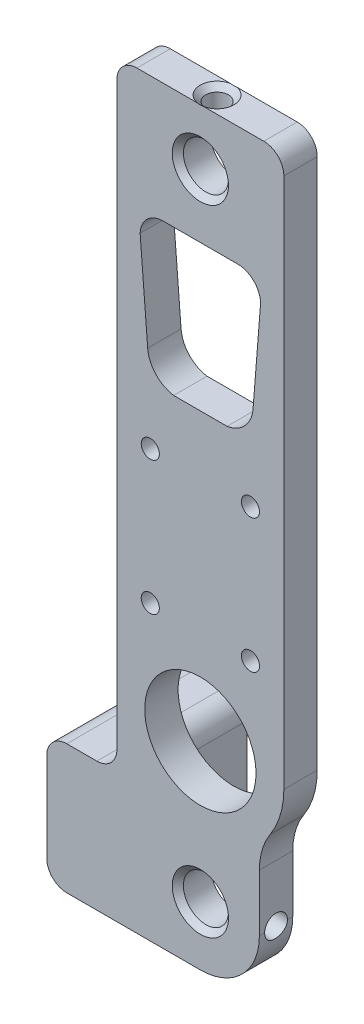
from build123d import *

# Parameters (mm, degrees)
SKETCH1_W           = 30
SKETCH1_H           = 34
SKETCH1_R           = 1.625
BOSS_EXTRUDE1_DEPTH = 6
BOSS_EXTRUDE3_START = -6
SKETCH2_R           = 10
SKETCH2_R_2         = 4.05
BOSS_EXTRUDE3_DEPTH = 6
SKETCH3_R           = 2.1
BOSS_EXTRUDE4_DEPTH = 21.376405408
CUT_EXTRUDE1_START  = -10
CUT_EXTRUDE1_DEPTH  = 10
SKETCH5_W           = 4.7
SKETCH5_H           = 23.2
BOSS_EXTRUDE5_DEPTH = 17.376405408
CUT_EXTRUDE2_DEPTH  = 10
SKETCH8_R           = 2.05
CUT_EXTRUDE3_DEPTH  = 10
SKETCH9_W           = 30
SKETCH9_H           = 53.05
SKETCH9_R           = 4.05
BOSS_EXTRUDE6_DEPTH = 6
SKETCH10_R          = 2.05
CUT_EXTRUDE7_DEPTH  = 10
FILLET2_R           = 3.6
FILLET3_R           = 3.6
CHAMFER1_SIZE       = 1
CHAMFER2_SIZE       = 1


with BuildPart() as part:
    # Sketch1 → Boss-Extrude1 (new body)
    with BuildSketch(Plane.XY):
        Rectangle(SKETCH1_W, SKETCH1_H)
        with Locations((-9, 12)):
            Circle(SKETCH1_R, mode=Mode.SUBTRACT)
        with Locations((9, 12)):
            Circle(SKETCH1_R, mode=Mode.SUBTRACT)
        with Locations((-9, -12)):
            Circle(SKETCH1_R, mode=Mode.SUBTRACT)
        with Locations((9, -12)):
            Circle(SKETCH1_R, mode=Mode.SUBTRACT)
    extrude(amount=-BOSS_EXTRUDE1_DEPTH)

    # Sketch2 → Boss-Extrude3 (add)
    with BuildSketch(Plane.XY.offset(BOSS_EXTRUDE3_START)):
        Polygon((-15, -17), (15, -17), (15, -64.6), (-15, -64.6), (-27.6, -64.6), (-27.6, -41.4), (-15, -41.4), align=None)
        with Locations((0, -29)):
            Circle(SKETCH2_R, mode=Mode.SUBTRACT)
        with Locations((0, -54)):
            Circle(SKETCH2_R_2, mode=Mode.SUBTRACT)
    extrude(amount=BOSS_EXTRUDE3_DEPTH)

    # Sketch3 → Boss-Extrude4 (add)
    with BuildSketch(Plane(origin=(0, 0, -6), x_dir=(-1, 0, 0), z_dir=(0, 0, -1))):
        with BuildLine():
            Line((27.6, -61), (27.6, -45))
            ThreePointArc((27.6, -45), (26.545584412, -42.454415588), (24, -41.4))
            Line((24, -41.4), (19.7, -41.4))
            Line((19.7, -41.4), (19.7, -64.6))
            Line((19.7, -64.6), (24, -64.6))
            ThreePointArc((24, -64.6), (26.545584412, -63.545584412), (27.6, -61))
        make_face()
        with Locations(Location((24, -61, 0), (0, 0, 180))):
            Circle(SKETCH3_R, mode=Mode.SUBTRACT)
        with Locations(Location((24, -45, 0), (0, 0, 180))):
            Circle(SKETCH3_R, mode=Mode.SUBTRACT)
    extrude(amount=BOSS_EXTRUDE4_DEPTH)

    # Sketch4 → Cut-Extrude1 (cut)
    with BuildSketch(Plane(origin=(0, 0, -6), x_dir=(-1, 0, 0), z_dir=(0, 0, -1)).offset(CUT_EXTRUDE1_START)):
        with BuildLine():
            ThreePointArc((27.6, -61), (26.545584412, -63.545584412), (24, -64.6))
            Line((24, -64.6), (27.6, -64.6))
            Line((27.6, -64.6), (27.6, -61))
        make_face()
        with BuildLine():
            ThreePointArc((24, -41.4), (26.545584412, -42.454415588), (27.6, -45))
            Line((27.6, -45), (27.6, -41.4))
            Line((27.6, -41.4), (24, -41.4))
        make_face()
    extrude(amount=CUT_EXTRUDE1_DEPTH, mode=Mode.SUBTRACT)

    # Sketch5 → Boss-Extrude5 (add)
    with BuildSketch(Plane(origin=(0, 0, -6), x_dir=(-1, 0, 0), z_dir=(0, 0, -1))):
        with Locations((17.35, -53)):
            Rectangle(SKETCH5_W, SKETCH5_H)
    extrude(amount=BOSS_EXTRUDE5_DEPTH)

    # Sketch7 → Cut-Extrude2 (cut)
    with BuildSketch(Plane(origin=(0, 0, -6), x_dir=(-1, 0, 0), z_dir=(0, 0, -1))):
        with BuildLine():
            ThreePointArc((0, -64.6), (-7.495331881, -61.495331881), (-10.6, -54))
            Line((-10.6, -54), (-10.6, -43.756336497))
            ThreePointArc((-10.6, -43.756336497), (-11.098006621, -40.343327835), (-12.550498477, -37.214924709))
            ThreePointArc((-12.550498477, -37.214924709), (-14.374586553, -33.286170951), (-15, -29))
            Line((-15, -29), (-15, -64.6))
            Line((-15, -64.6), (0, -64.6))
        make_face()
    extrude(amount=-CUT_EXTRUDE2_DEPTH, mode=Mode.SUBTRACT)

    # Sketch8 → Cut-Extrude3 (cut)
    with BuildSketch(Plane(origin=(10.6, 0, 0), x_dir=(0, 0, -1), z_dir=(1, 0, 0))):
        with Locations((3, -54)):
            Circle(SKETCH8_R)
    extrude(amount=-CUT_EXTRUDE3_DEPTH, mode=Mode.SUBTRACT)

    # Sketch9 → Boss-Extrude6 (add)
    with BuildSketch(Plane.XY):
        with Locations((0, 43.525)):
            Rectangle(SKETCH9_W, SKETCH9_H)
        with Locations((0, 60)):
            Circle(SKETCH9_R, mode=Mode.SUBTRACT)
        with BuildLine():
            Line((-6.706665949, 48.593809049), (6.706665949, 48.593809049))
            ThreePointArc((6.706665949, 48.593809049), (9.567126212, 47.439316621), (10.824837954, 44.622714616))
            Line((10.824837954, 44.622714616), (9.466318981, 27.423327073))
            ThreePointArc((9.466318981, 27.423327073), (8.007195381, 24.098965988), (4.799877304, 22.397928344))
            Line((4.799877304, 22.397928344), (-4.799877304, 22.397928344))
            ThreePointArc((-4.799877304, 22.397928344), (-8.007195381, 24.098965988), (-9.466318981, 27.423327073))
            Line((-9.466318981, 27.423327073), (-10.824837954, 44.622714616))
            ThreePointArc((-10.824837954, 44.622714616), (-9.567126212, 47.439316621), (-6.706665949, 48.593809049))
        make_face(mode=Mode.SUBTRACT)
    extrude(amount=-BOSS_EXTRUDE6_DEPTH)

    # Sketch10 → Cut-Extrude7 (cut)
    with BuildSketch(Plane(origin=(0, 70.05, 0), x_dir=(1, 0, 0), z_dir=(0, 1, 0))):
        with Locations(Location((0, 3, 0), (0, 0, 270))):
            Circle(SKETCH10_R)
    extrude(amount=-CUT_EXTRUDE7_DEPTH, mode=Mode.SUBTRACT)

    # Fillet2
    fillet2_edges = [part.edges().sort_by_distance(p)[0] for p in [
        (15, 70.05, -3),
        (-15, 70.05, -3),
        (-15, -41.4, -3),
    ]]
    fillet(fillet2_edges, radius=FILLET2_R)

    # Fillet3
    fillet3_edges = [part.edges().sort_by_distance(p)[0] for p in [
        (-15, -41.4, -14.688202704),
    ]]
    fillet(fillet3_edges, radius=FILLET3_R)

    # Chamfer1
    # the kernel refuses this chamfer: 1 mm, written as the material it takes off along each edge
    with BuildSketch(Plane(origin=(0, 70.05, -3), x_dir=(0, 0, 1), z_dir=(-1, 0, 0))) as chamfer1_piece_1:
        Polygon((2.05 + CHAMFER1_SIZE, 0), (2.05, -CHAMFER1_SIZE), (2.05, 0), align=None)
    revolve(axis=Axis((0, 70.05, -3), (0, 1, 0)), mode=Mode.SUBTRACT)
    with BuildSketch(Plane(origin=(-24, -45, -27.376405408), x_dir=(1, 0, 0), z_dir=(0, 1, 0))) as chamfer1_piece_2:
        Polygon((2.1 + CHAMFER1_SIZE, 0), (2.1, -CHAMFER1_SIZE), (2.1, 0), align=None)
    revolve(axis=Axis((-24, -45, -27.376405408), (0, 0, -1)), mode=Mode.SUBTRACT)
    with BuildSketch(Plane(origin=(-24, -61, -27.376405408), x_dir=(1, 0, 0), z_dir=(0, 1, 0))) as chamfer1_piece_3:
        Polygon((2.1 + CHAMFER1_SIZE, 0), (2.1, -CHAMFER1_SIZE), (2.1, 0), align=None)
    revolve(axis=Axis((-24, -61, -27.376405408), (0, 0, -1)), mode=Mode.SUBTRACT)

    # Chamfer2
    # the kernel refuses this chamfer: 1 mm, written as the material it takes off along each edge
    with BuildSketch(Plane(origin=(0, -54, 0), x_dir=(1, 0, 0), z_dir=(0, -1, 0))) as chamfer2_piece_1:
        Polygon((4.05, -CHAMFER2_SIZE), (4.05 + CHAMFER2_SIZE, 0), (4.05, 0), align=None)
    revolve(axis=Axis((0, -54, 0), (0, 0, 1)), mode=Mode.SUBTRACT)
    with BuildSketch(Plane(origin=(0, 60, 0), x_dir=(1, 0, 0), z_dir=(0, -1, 0))) as chamfer2_piece_2:
        Polygon((4.05, -CHAMFER2_SIZE), (4.05 + CHAMFER2_SIZE, 0), (4.05, 0), align=None)
    revolve(axis=Axis((0, 60, 0), (0, 0, 1)), mode=Mode.SUBTRACT)


solid = part.part
